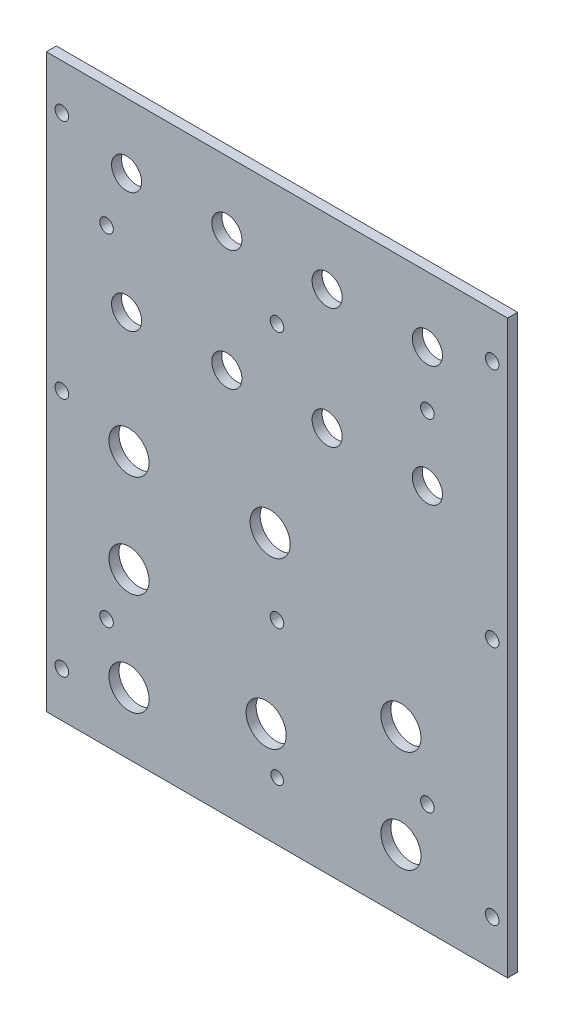
from build123d import *

# Parameters (mm, degrees)
SKETCH1_W                       = 146.05
SKETCH1_H                       = 180.975
BOSS_EXTRUDE1_DEPTH             = 3.175
F_6_CLEARANCE_HOLE1_D           = 4.3053
F_3_8_0_375_DIAMETER_HOLE1_D    = 9.525
F_1_2_0_5_DIAMETER_HOLE1_D      = 12.7
F_5_32_0_15625_DIAMETER_HOLE1_D = 3.96875


with BuildPart() as part:
    # Sketch1 → Boss-Extrude1 (new body)
    with BuildSketch(Plane.XY):
        with Locations((-73.025, 90.4875)):
            Rectangle(SKETCH1_W, SKETCH1_H)
    extrude(amount=-BOSS_EXTRUDE1_DEPTH)

    # #6 Clearance Hole1 (through all)
    with Locations(Plane(origin=(0, 0, -3.175), x_dir=(-1, 0, 0), z_dir=(0, 0, -1))):
        with Locations((25.4, 142.875), (73.025, 142.875), (127, 142.875), (25.4, 34.925), (73.025, 61.647038728), (127, 34.925), (4.8895, 14.2875), (141.1605, 14.2875), (4.8895, 90.4875), (141.1605, 90.4875), (141.1605, 166.6875), (4.8895, 166.6875)):
            Hole(F_6_CLEARANCE_HOLE1_D / 2)

    # 3/8 (0.375) Diameter Hole1 (through all)
    with Locations(Plane(origin=(0, 0, -3.175), x_dir=(-1, 0, 0), z_dir=(0, 0, -1))):
        with Locations((25.4, 160.3248), (57.15, 160.3248), (88.9, 160.3248), (120.65, 160.3248), (25.4, 122.2248), (57.15, 122.2248), (88.9, 122.2248), (120.65, 122.2248)):
            Hole(F_3_8_0_375_DIAMETER_HOLE1_D / 2)

    # 1/2 (0.5) Diameter Hole1 (through all)
    with Locations(Plane(origin=(0, 0, -3.175), x_dir=(-1, 0, 0), z_dir=(0, 0, -1))):
        with Locations((75.184, 84.455), (119.888, 84.455), (119.888, 52.07), (33.782, 52.07), (33.782, 19.685), (119.888, 19.685), (76.454, 31.496)):
            Hole(F_1_2_0_5_DIAMETER_HOLE1_D / 2)

    # 5/32 (0.15625) Diameter Hole1 (through all)
    with Locations(Plane(origin=(0, 0, -3.175), x_dir=(-1, 0, 0), z_dir=(0, 0, -1))):
        with Locations((72.963204011, 18.468172011)):
            Hole(F_5_32_0_15625_DIAMETER_HOLE1_D / 2)


solid = part.part
